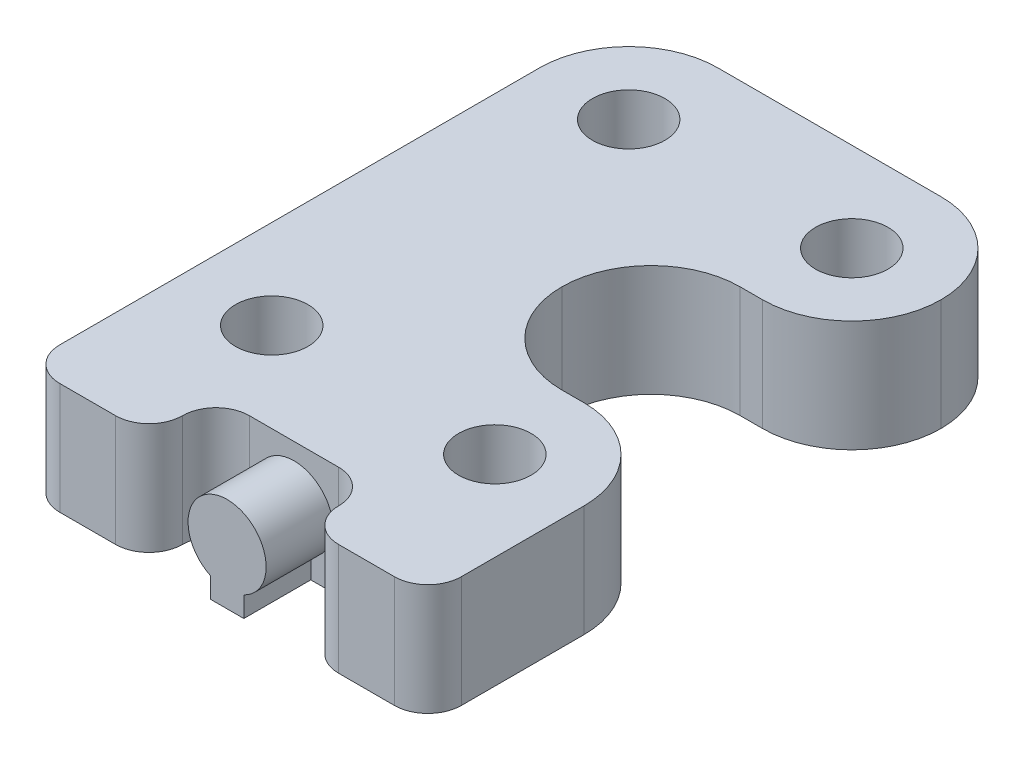
from build123d import *

# Parameters (mm, degrees)
SKETCH1_R           = 1.625
BOSS_EXTRUDE1_DEPTH = 5
FILLET1_R           = 4
FILLET3_R           = 1.5
BOSS_EXTRUDE2_DEPTH = 3


with BuildPart() as part:
    # Sketch1 → Boss-Extrude1 (new body)
    with BuildSketch(Plane(origin=(0, 0, 0), x_dir=(1, 0, 0), z_dir=(0, 1, 0))):
        Polygon((0, 0), (5.5, 0), (5.5, 3), (12.5, 3), (12.5, 0), (18, 0), (18, 11), (9, 11), (9, 19), (18, 19), (18, 27), (0, 27), align=None)
        with Locations(Location((4, 23, 0), (0, 0, 270))):
            Circle(SKETCH1_R, mode=Mode.SUBTRACT)
        with Locations(Location((14, 23, 0), (0, 0, 270))):
            Circle(SKETCH1_R, mode=Mode.SUBTRACT)
        with Locations(Location((14, 7, 0), (0, 0, 270))):
            Circle(SKETCH1_R, mode=Mode.SUBTRACT)
        with Locations(Location((4, 7, 0), (0, 0, 270))):
            Circle(SKETCH1_R, mode=Mode.SUBTRACT)
    extrude(amount=BOSS_EXTRUDE1_DEPTH)

    # Fillet1
    fillet1_edges = [part.edges().sort_by_distance(p)[0] for p in [
        (9, 2.5, -11),
        (9, 2.5, -19),
        (18, 2.5, -11),
        (0, 2.5, -27),
        (18, 2.5, -27),
        (18, 2.5, -19),
    ]]
    fillet(fillet1_edges, radius=FILLET1_R - 0.0001)  # a hair under: the kernel refuses the full size

    # Fillet3
    fillet3_edges = [part.edges().sort_by_distance(p)[0] for p in [
        (12.5, 2.5, -3),
        (18, 2.5, 0),
        (12.5, 2.5, 0),
        (5.5, 2.5, -3),
        (5.5, 2.5, 0),
        (0, 2.5, 0),
    ]]
    fillet(fillet3_edges, radius=FILLET3_R - 0.0001)  # a hair under: the kernel refuses the full size

    # Sketch3 → Boss-Extrude2 (add)
    with BuildSketch(Plane.XY.offset(-3)):
        with BuildLine():
            Line((8.25, 0.91886117), (8.25, 0))
            Line((8.25, 0), (9.75, 0))
            Line((9.75, 0), (9.75, 0.91886117))
            ThreePointArc((9.75, 0.91886117), (9, 4.25), (8.25, 0.91886117))
        make_face()
    extrude(amount=BOSS_EXTRUDE2_DEPTH)


solid = part.part
